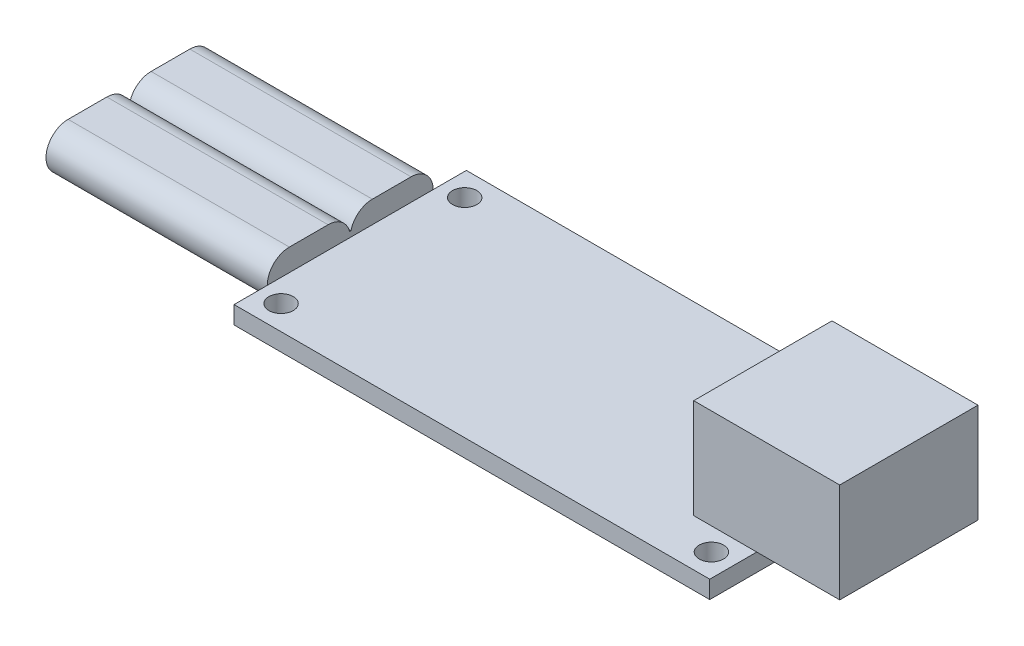
from build123d import *

# Parameters (mm, degrees)
SKETCH1_W           = 43
SKETCH1_H           = 21
SKETCH1_R           = 1.1
BOSS_EXTRUDE1_DEPTH = 1.6
BOSS_EXTRUDE2_DEPTH = 20
SKETCH3_W           = 13.2
SKETCH3_H           = 12.5
BOSS_EXTRUDE3_DEPTH = 9


with BuildPart() as part:
    # Sketch1 → Boss-Extrude1 (new body)
    with BuildSketch(Plane(origin=(0, 0, 0), x_dir=(1, 0, 0), z_dir=(0, 1, 0))):
        with Locations((21.5, 10.5)):
            Rectangle(SKETCH1_W, SKETCH1_H)
        with Locations((2.05, 18.8)):
            Circle(SKETCH1_R, mode=Mode.SUBTRACT)
        with Locations((40.95, 18.8)):
            Circle(SKETCH1_R, mode=Mode.SUBTRACT)
        with Locations((40.95, 2.2)):
            Circle(SKETCH1_R, mode=Mode.SUBTRACT)
        with Locations((2.05, 2.2)):
            Circle(SKETCH1_R, mode=Mode.SUBTRACT)
    extrude(amount=BOSS_EXTRUDE1_DEPTH)

    # Sketch2 → Boss-Extrude2 (add)
    with BuildSketch(Plane.ZY):
        with BuildLine():
            Line((-16, -0.4), (-12.5, -0.4))
            ThreePointArc((-12.5, -0.4), (-11.273655175, 0.020101785), (-10.5625, 1.103921629))
            ThreePointArc((-10.5625, 1.103921629), (-10.5, 1.1), (-10.4375, 1.103921629))
            ThreePointArc((-10.4375, 1.103921629), (-9.726344825, 0.020101785), (-8.5, -0.4))
            Line((-8.5, -0.4), (-5, -0.4))
            ThreePointArc((-5, -0.4), (-3, 1.6), (-5, 3.6))
            Line((-5, 3.6), (-8.5, 3.6))
            ThreePointArc((-8.5, 3.6), (-9.726344825, 3.179898215), (-10.4375, 2.096078371))
            ThreePointArc((-10.4375, 2.096078371), (-10.5, 2.1), (-10.5625, 2.096078371))
            ThreePointArc((-10.5625, 2.096078371), (-11.273655175, 3.179898215), (-12.5, 3.6))
            Line((-12.5, 3.6), (-16, 3.6))
            ThreePointArc((-16, 3.6), (-18, 1.6), (-16, -0.4))
        make_face()
    extrude(amount=BOSS_EXTRUDE2_DEPTH)

    # Sketch3 → Boss-Extrude3 (add)
    with BuildSketch(Plane(origin=(0, 1.6, 0), x_dir=(1, 0, 0), z_dir=(0, 1, 0))):
        with Locations((43.9, 10.5)):
            Rectangle(SKETCH3_W, SKETCH3_H)
    extrude(amount=BOSS_EXTRUDE3_DEPTH)


solid = part.part
